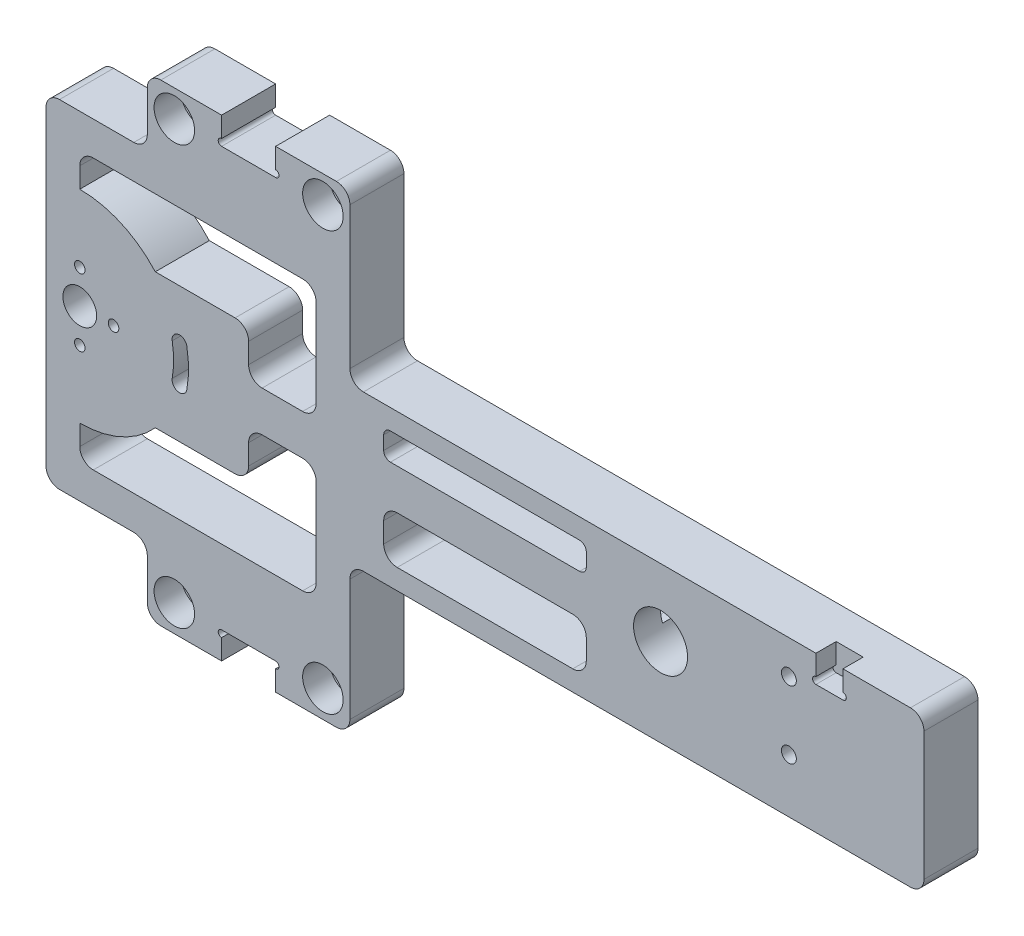
from build123d import *

# Parameters (mm, degrees)
BOSS_EXTRUDE1_DEPTH       = 8
SKETCH3_R                 = 3
CUT_EXTRUDE1_DEPTH        = 4
SKETCH3_3_R               = 1.6
CUT_EXTRUDE2_DEPTH        = 8
CUT_EXTRUDE13_DEPTH       = 10
SKETCH4_R                 = 2.5
SKETCH4_R_2               = 0.7835
CUT_EXTRUDE3_DEPTH        = 4
SKETCH4_2_R               = 2.5
SKETCH4_2_R_2             = 0.7835
CUT_EXTRUDE4_DEPTH        = 8
FILLET1_R                 = 2
SKETCH6_R                 = 2
CUT_EXTRUDE6_DEPTH        = 4
SKETCH6_3_R               = 1.1
CUT_EXTRUDE7_DEPTH        = 8
SKETCH7_R                 = 4
CUT_EXTRUDE8_DEPTH        = 8
CUT_EXTRUDE9_DEPTH        = 4
SKETCH9_W                 = 30
SKETCH9_H                 = 4
SKETCH9_H_2               = 7
CUT_EXTRUDE10_DEPTH       = 8
FILLET2_R                 = 2
FILLET3_R                 = 1
F_3_0MM_DOWEL_HOLE1_D     = 3
F_3_0MM_DOWEL_HOLE1_DEPTH = 6.098709071
F_3_0MM_DOWEL_HOLE1_TIP   = 0.901290929
F_2_5MM_DOWEL_HOLE1_D     = 2.5
F_2_5MM_DOWEL_HOLE1_DEPTH = 4
F_2_5MM_DOWEL_HOLE1_TIP   = 0.751075774
CUT_EXTRUDE11_DEPTH       = 4
CUT_EXTRUDE12_DEPTH       = 8
CUT_EXTRUDE14_DEPTH       = 3


with BuildPart() as part:
    # Sketch1 → Boss-Extrude1 (new body)
    with BuildSketch(Plane.XY):
        Polygon((-65, 25), (-65, -25), (-50, -25), (-50, -35), (-20, -35), (-20, -13), (65, -13), (65, 10), (-20, 10), (-20, 35), (-50, 35), (-50, 25), align=None)
    extrude(amount=BOSS_EXTRUDE1_DEPTH)

    # Sketch3 → Cut-Extrude1 (cut)
    with BuildSketch(Plane.XY.offset(8)):
        with Locations((-46, -31)):
            Circle(SKETCH3_R)
        with Locations((-24, -31)):
            Circle(SKETCH3_R)
    cut_extrude1 = extrude(amount=-CUT_EXTRUDE1_DEPTH, mode=Mode.SUBTRACT)

    # Sketch3<3> → Cut-Extrude2 (cut)
    with BuildSketch(Plane.XY.offset(8)):
        with Locations((-46, -31)):
            Circle(SKETCH3_3_R)
        with Locations((-24, -31)):
            Circle(SKETCH3_3_R)
    cut_extrude2 = extrude(amount=-CUT_EXTRUDE2_DEPTH, mode=Mode.SUBTRACT)

    # Sketch22 → Cut-Extrude13 (cut)
    with BuildSketch(Plane.XY.offset(8)):
        with BuildLine():
            Line((-39, -31), (-31, -31))
            ThreePointArc((-31, -31), (-30.5, -31.5), (-31, -32))
            Line((-31, -32), (-31, -35))
            Line((-31, -35), (-39, -35))
            Line((-39, -35), (-39, -32))
            ThreePointArc((-39, -32), (-39.5, -31.5), (-39, -31))
        make_face()
    cut_extrude13 = extrude(amount=-CUT_EXTRUDE13_DEPTH, mode=Mode.SUBTRACT)

    # Mirror1: Cut-Extrude1, Cut-Extrude2, Cut-Extrude13 across plane
    add(cut_extrude1.mirror(Plane.ZX), mode=Mode.SUBTRACT)
    add(cut_extrude2.mirror(Plane.ZX), mode=Mode.SUBTRACT)
    add(cut_extrude13.mirror(Plane.ZX), mode=Mode.SUBTRACT)

    # Sketch4 → Cut-Extrude3 (cut)
    with BuildSketch(Plane(origin=(0, 0, 0), x_dir=(-1, 0, 0), z_dir=(0, 0, -1))):
        with BuildLine():
            Line((65, 6.244997998), (65, -6.244997998))
            ThreePointArc((65, -6.244997998), (52, 0), (65, 6.244997998))
        make_face()
        with Locations((60, 0)):
            Circle(SKETCH4_R, mode=Mode.SUBTRACT)
        with Locations((60, 5)):
            Circle(SKETCH4_R_2, mode=Mode.SUBTRACT)
        with Locations((55, 0)):
            Circle(SKETCH4_R_2, mode=Mode.SUBTRACT)
        with Locations((60, -5)):
            Circle(SKETCH4_R_2, mode=Mode.SUBTRACT)
    extrude(amount=-CUT_EXTRUDE3_DEPTH, mode=Mode.SUBTRACT)

    # Sketch4<2> → Cut-Extrude4 (cut)
    with BuildSketch(Plane(origin=(0, 0, 0), x_dir=(-1, 0, 0), z_dir=(0, 0, -1))):
        with Locations((60, 0)):
            Circle(SKETCH4_2_R)
        with Locations((60, 5)):
            Circle(SKETCH4_2_R_2)
        with Locations((55, 0)):
            Circle(SKETCH4_2_R_2)
        with Locations((60, -5)):
            Circle(SKETCH4_2_R_2)
    extrude(amount=-CUT_EXTRUDE4_DEPTH, mode=Mode.SUBTRACT)

    # Fillet1
    fillet1_edges = [part.edges().sort_by_distance(p)[0] for p in [
        (-65, -25, 4),
        (-50, -25, 4),
        (-50, -35, 4),
        (-20, -35, 4),
        (-20, -13, 4),
        (65, -13, 4),
        (65, 10, 4),
        (-20, 10, 4),
        (-20, 35, 4),
        (-50, 35, 4),
        (-50, 25, 4),
        (-65, 25, 4),
    ]]
    fillet(fillet1_edges, radius=FILLET1_R)

    # Sketch6 → Cut-Extrude6 (cut)
    with BuildSketch(Plane(origin=(0, 0, 0), x_dir=(-1, 0, 0), z_dir=(0, 0, -1))):
        with Locations((-45, 5)):
            Circle(SKETCH6_R)
        with Locations((-45, -5)):
            Circle(SKETCH6_R)
    extrude(amount=-CUT_EXTRUDE6_DEPTH, mode=Mode.SUBTRACT)

    # Sketch6<3> → Cut-Extrude7 (cut)
    with BuildSketch(Plane(origin=(0, 0, 0), x_dir=(-1, 0, 0), z_dir=(0, 0, -1))):
        with Locations((-45, 5)):
            Circle(SKETCH6_3_R)
        with Locations((-45, -5)):
            Circle(SKETCH6_3_R)
    extrude(amount=-CUT_EXTRUDE7_DEPTH, mode=Mode.SUBTRACT)

    # Sketch7 → Cut-Extrude8 (cut)
    with BuildSketch(Plane(origin=(0, 0, 0), x_dir=(-1, 0, 0), z_dir=(0, 0, -1))):
        with Locations((-26, 0)):
            Circle(SKETCH7_R)
    extrude(amount=-CUT_EXTRUDE8_DEPTH, mode=Mode.SUBTRACT)

    # Sketch7<3> → Cut-Extrude9 (cut)
    with BuildSketch(Plane(origin=(0, 0, 0), x_dir=(-1, 0, 0), z_dir=(0, 0, -1))):
        with BuildLine():
            Line((-31, 1.5), (-21, 1.5))
            ThreePointArc((-21, 1.5), (-19.5, 0), (-21, -1.5))
            Line((-21, -1.5), (-31, -1.5))
            ThreePointArc((-31, -1.5), (-32.5, 0), (-31, 1.5))
        make_face()
    extrude(amount=-CUT_EXTRUDE9_DEPTH, mode=Mode.SUBTRACT)

    # Sketch9 → Cut-Extrude10 (cut)
    with BuildSketch(Plane(origin=(0, 0, 0), x_dir=(-1, 0, 0), z_dir=(0, 0, -1))):
        with BuildLine():
            Line((35, 10), (35, 3))
            Line((35, 3), (25, 3))
            Line((25, 3), (25, 20))
            Line((25, 20), (60, 20))
            Line((60, 20), (60, 15))
            ThreePointArc((60, 15), (53.876275643, 13.693063938), (48.819660113, 10))
            Line((48.819660113, 10), (35, 10))
        make_face()
        with BuildLine():
            Line((35, -10), (48.819660113, -10))
            ThreePointArc((48.819660113, -10), (53.876275643, -13.693063938), (60, -15))
            Line((60, -15), (60, -20))
            Line((60, -20), (25, -20))
            Line((25, -20), (25, -3))
            Line((25, -3), (35, -3))
            Line((35, -3), (35, -10))
        make_face()
        with Locations((0, 5)):
            Rectangle(SKETCH9_W, SKETCH9_H)
        with Locations((0, -6.5)):
            Rectangle(SKETCH9_W, SKETCH9_H_2)
    extrude(amount=-CUT_EXTRUDE10_DEPTH, mode=Mode.SUBTRACT)

    # Fillet2
    fillet2_edges = [part.edges().sort_by_distance(p)[0] for p in [
        (-25, -20, 4),
        (-35, -10, 4),
        (-35, -3, 4),
        (-25, -3, 4),
        (-35, 10, 4),
        (-35, 3, 4),
        (-25, 3, 4),
        (-60, 20, 4),
        (-25, 20, 4),
        (-15, -10, 4),
        (15, -10, 4),
        (-15, -3, 4),
        (15, -3, 4),
        (-60, -20, 4),
    ]]
    fillet(fillet2_edges, radius=FILLET2_R)

    # Fillet3
    fillet3_edges = [part.edges().sort_by_distance(p)[0] for p in [
        (-15, 3, 4),
        (-15, 7, 4),
        (15, 7, 4),
        (15, 3, 4),
    ]]
    fillet(fillet3_edges, radius=FILLET3_R)

    # Ø3.0mm Dowel Hole1
    with Locations(Plane(origin=(0, -13, 0), x_dir=(-1, 0, 0), z_dir=(0, -1, 0))):
        with Locations((-38, -4), (-53, -4)):
            Hole(F_3_0MM_DOWEL_HOLE1_D / 2, depth=F_3_0MM_DOWEL_HOLE1_DEPTH)
            with Locations((0, 0, -(F_3_0MM_DOWEL_HOLE1_DEPTH + F_3_0MM_DOWEL_HOLE1_TIP / 2))):  # 118° drill point
                Cone(0, F_3_0MM_DOWEL_HOLE1_D / 2, F_3_0MM_DOWEL_HOLE1_TIP, mode=Mode.SUBTRACT)

    # Ø2.5mm Dowel Hole1
    with Locations(Plane(origin=(0, -13, 0), x_dir=(-1, 0, 0), z_dir=(0, -1, 0))):
        with Locations((-48, -4), (-43, -4)):
            Hole(F_2_5MM_DOWEL_HOLE1_D / 2, depth=F_2_5MM_DOWEL_HOLE1_DEPTH)
            with Locations((0, 0, -(F_2_5MM_DOWEL_HOLE1_DEPTH + F_2_5MM_DOWEL_HOLE1_TIP / 2))):  # 118° drill point
                Cone(0, F_2_5MM_DOWEL_HOLE1_D / 2, F_2_5MM_DOWEL_HOLE1_TIP, mode=Mode.SUBTRACT)

    # Sketch21 → Cut-Extrude11 (cut)
    with BuildSketch(Plane(origin=(0, 0, 0), x_dir=(-1, 0, 0), z_dir=(0, 0, -1))):
        with BuildLine():
            ThreePointArc((43.258268199, 2.95201902), (43, 0), (43.258268199, -2.95201902))
            ThreePointArc((43.258268199, -2.95201902), (45.57518006, -4.574338171), (47.197499211, -2.25742631))
            ThreePointArc((47.197499211, -2.25742631), (47, 0), (47.197499211, 2.25742631))
            ThreePointArc((47.197499211, 2.25742631), (45.57518006, 4.574338171), (43.258268199, 2.95201902))
        make_face()
    extrude(amount=-CUT_EXTRUDE11_DEPTH, mode=Mode.SUBTRACT)

    # Sketch21<3> → Cut-Extrude12 (cut)
    with BuildSketch(Plane(origin=(0, 0, 0), x_dir=(-1, 0, 0), z_dir=(0, 0, -1))):
        with BuildLine():
            ThreePointArc((44.144595177, 2.79573566), (43.9, 0), (44.144595177, -2.79573566))
            ThreePointArc((44.144595177, -2.79573566), (45.4188967, -3.688011193), (46.311172233, -2.41370967))
            ThreePointArc((46.311172233, -2.41370967), (46.1, 0), (46.311172233, 2.41370967))
            ThreePointArc((46.311172233, 2.41370967), (45.4188967, 3.688011193), (44.144595177, 2.79573566))
        make_face()
    extrude(amount=-CUT_EXTRUDE12_DEPTH, mode=Mode.SUBTRACT)

    # Sketch23 → Cut-Extrude14 (cut)
    with BuildSketch(Plane.XY.offset(8)):
        with BuildLine():
            Line((49, 10), (53, 10))
            Line((53, 10), (53, 7))
            ThreePointArc((53, 7), (53.5, 6.5), (53, 6))
            Line((53, 6), (49, 6))
            ThreePointArc((49, 6), (48.5, 6.5), (49, 7))
            Line((49, 7), (49, 10))
        make_face()
    extrude(amount=-CUT_EXTRUDE14_DEPTH, mode=Mode.SUBTRACT)


solid = part.part
